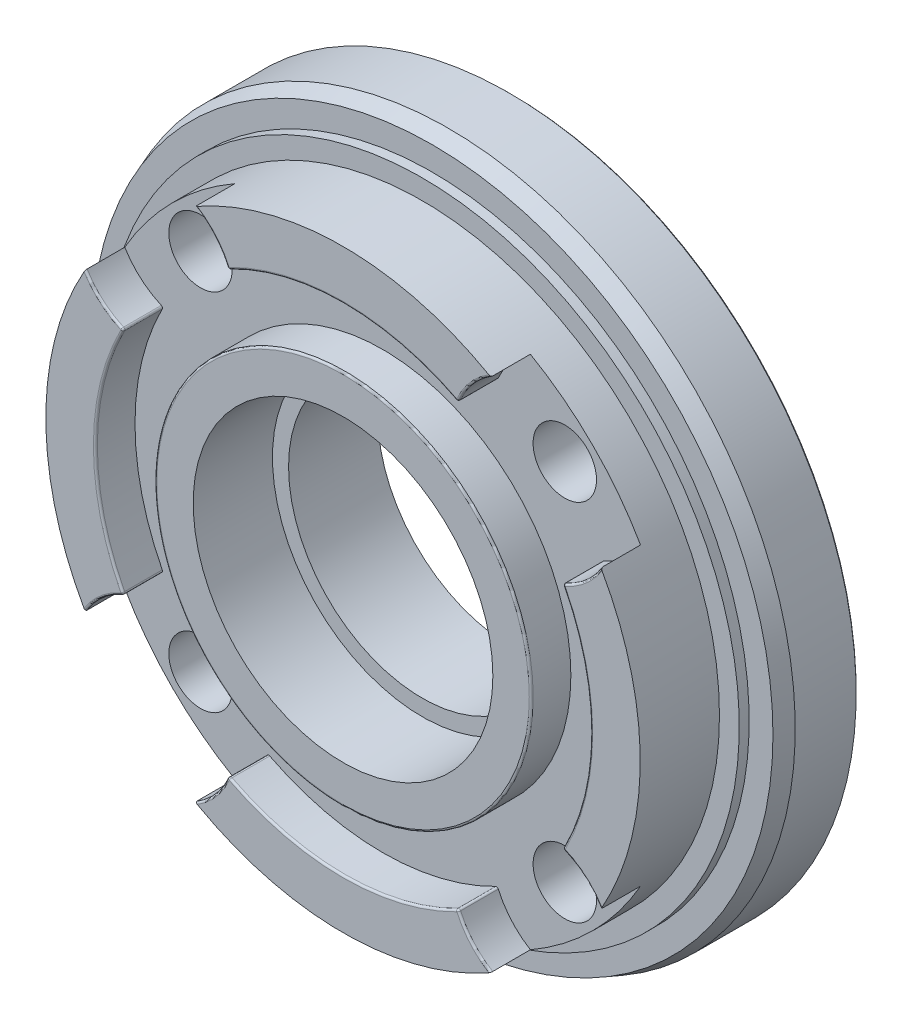
from build123d import *

# Parameters (mm, degrees)
BOSS_EXTRUDE1_DEPTH     = 2
BOSS_EXTRUDE1_2_DEPTH   = 2
BOSS_EXTRUDE1_3_DEPTH   = 2
BOSS_EXTRUDE1_4_DEPTH   = 2
SKETCH1_R               = 9.5
SKETCH1_R_2             = 7.5625
BOSS_EXTRUDE1_5_DEPTH   = 2
BOSS_EXTRUDE2_START     = -2
SKETCH2_R               = 15
BOSS_EXTRUDE2_DEPTH     = 2
FILLET1_R               = 0.1
FILLET2_R               = 0.1
SKETCH4_R               = 16
BOSS_EXTRUDE3_DEPTH     = 0.5
SKETCH5_R               = 17.5
BOSS_EXTRUDE4_DEPTH     = 4
CUT_EXTRUDE2_DEPTH      = 26.154522456
CUT_EXTRUDE2_DEPTH_BACK = 26.154522456
SKETCH3_R               = 1.6
SKETCH6_R               = 2.1
CUT_EXTRUDE3_DEPTH      = 4
SKETCH7_R               = 2.6
CUT_EXTRUDE4_DEPTH      = 4
SKETCH8_R               = 6.75
MIDDLE_CUTOUT_DEPTH     = 7
CHAMFER1_SIZE           = 0.1
CUT_EXTRUDE6_START      = -2
SKETCH9_R               = 7.5625
CUT_EXTRUDE6_DEPTH      = 2
CHAMFER2_SIZE           = 0.3
CHAMFER2_SIZE2          = 0.824243226


with BuildPart() as part:
    # Sketch1 → Boss-Extrude1 (new body)
    with BuildSketch(Plane.XY):
        with BuildLine():
            ThreePointArc((5.795745748, 11.075167323), (6.469207051, 12.179609111), (7.456549067, 13.01537076))
            ThreePointArc((7.456549067, 13.01537076), (0, 15), (-7.456549067, 13.01537076))
            ThreePointArc((-7.456549067, 13.01537076), (-6.469207051, 12.179609111), (-5.795745748, 11.075167323))
            ThreePointArc((-5.795745748, 11.075167323), (0, 12.5), (5.795745748, 11.075167323))
        make_face()
    extrude(amount=BOSS_EXTRUDE1_DEPTH)



with BuildPart() as body_2:
    # Sketch1 → Boss-Extrude1 2 (new body)
    with BuildSketch(Plane.XY):
        with BuildLine():
            ThreePointArc((13.01537076, -7.456549067), (14.495353762, -3.858071967), (15, 0))
            ThreePointArc((15, 0), (14.495353762, 3.858071967), (13.01537076, 7.456549067))
            ThreePointArc((13.01537076, 7.456549067), (12.179609111, 6.469207051), (11.075167323, 5.795745748))
            ThreePointArc((11.075167323, 5.795745748), (12.5, 0), (11.075167323, -5.795745748))
            ThreePointArc((11.075167323, -5.795745748), (12.179609111, -6.469207051), (13.01537076, -7.456549067))
        make_face()
    extrude(amount=BOSS_EXTRUDE1_2_DEPTH)


with BuildPart() as body_3:
    # Sketch1 → Boss-Extrude1 3 (new body)
    with BuildSketch(Plane.XY):
        with BuildLine():
            ThreePointArc((-7.456549067, -13.01537076), (0, -15), (7.456549067, -13.01537076))
            ThreePointArc((7.456549067, -13.01537076), (6.469207051, -12.179609111), (5.795745748, -11.075167323))
            ThreePointArc((5.795745748, -11.075167323), (0, -12.5), (-5.795745748, -11.075167323))
            ThreePointArc((-5.795745748, -11.075167323), (-6.469207051, -12.179609111), (-7.456549067, -13.01537076))
        make_face()
    extrude(amount=BOSS_EXTRUDE1_3_DEPTH)


with BuildPart() as body_4:
    # Sketch1 → Boss-Extrude1 4 (new body)
    with BuildSketch(Plane.XY):
        with BuildLine():
            ThreePointArc((-11.075167323, 5.795745748), (-12.179609111, 6.469207051), (-13.01537076, 7.456549067))
            ThreePointArc((-13.01537076, 7.456549067), (-15, 0), (-13.01537076, -7.456549067))
            ThreePointArc((-13.01537076, -7.456549067), (-12.179609111, -6.469207051), (-11.075167323, -5.795745748))
            ThreePointArc((-11.075167323, -5.795745748), (-12.5, 0), (-11.075167323, 5.795745748))
        make_face()
    extrude(amount=BOSS_EXTRUDE1_4_DEPTH)


with BuildPart() as body_5:
    # Sketch1 → Boss-Extrude1 5 (new body)
    with BuildSketch(Plane.XY):
        Circle(SKETCH1_R)
        Circle(SKETCH1_R_2, mode=Mode.SUBTRACT)
    extrude(amount=BOSS_EXTRUDE1_5_DEPTH)


with BuildPart() as part_1:
    add(part.part)

    add(body_2.part)  # Boss-Extrude2 merges body 2

    add(body_3.part)  # Boss-Extrude2 merges body 3

    add(body_4.part)  # Boss-Extrude2 merges body 4

    add(body_5.part)  # Boss-Extrude2 merges body 5
    # Sketch2 → Boss-Extrude2 (add)
    with BuildSketch(Plane.XY.offset(BOSS_EXTRUDE2_START)):
        with Locations(Location((0, 0, 0), (0, 0, 150.191461703))):
            Circle(SKETCH2_R)
    extrude(amount=BOSS_EXTRUDE2_DEPTH)

    # Fillet1
    fillet1_edges = [part_1.edges().sort_by_distance(p)[0] for p in [
        (11.075167323, 5.795745748, 1),
        (11.075167323, -5.795745748, 1),
        (5.795745748, -11.075167323, 1),
        (-5.795745748, -11.075167323, 1),
        (-11.075167323, -5.795745748, 1),
        (-11.075167323, 5.795745748, 1),
        (5.795745748, 11.075167323, 1),
        (-5.795745748, 11.075167323, 1),
    ]]
    fillet(fillet1_edges, radius=FILLET1_R)

    # Fillet2
    fillet2_edges = [part_1.edges().sort_by_distance(p)[0] for p in [
        (6.504180663, 12.219925602, 2),
        (12.219925602, -6.504180663, 2),
        (-6.504180663, -12.219925602, 2),
        (-12.219925602, 6.504180663, 2),
        (-9.5, 0, 2),
        (0, -12.5, 2),
        (6.504180663, -12.219925602, 2),
        (5.779303749, -11.119440592, 2),
        (-5.779303749, -11.119440592, 2),
        (12.5, 0, 2),
        (12.219925602, 6.504180663, 2),
        (11.119440592, 5.779303749, 2),
        (11.119440592, -5.779303749, 2),
        (0, 12.5, 2),
        (-6.504180663, 12.219925602, 2),
        (-5.779303749, 11.119440592, 2),
        (5.779303749, 11.119440592, 2),
        (-12.5, 0, 2),
        (-12.219925602, -6.504180663, 2),
        (-11.119440592, -5.779303749, 2),
        (-11.119440592, 5.779303749, 2),
    ]]
    fillet(fillet2_edges, radius=FILLET2_R - 0.0001)  # a hair under: the kernel refuses the full size

    # Sketch4 → Boss-Extrude3 (add)
    with BuildSketch(Plane(origin=(0, 0, -2), x_dir=(-1, 0, 0), z_dir=(0, 0, -1))):
        Circle(SKETCH4_R)
    extrude(amount=BOSS_EXTRUDE3_DEPTH)

    # Sketch5 → Boss-Extrude4 (add)
    with BuildSketch(Plane(origin=(0, 0, -2.5), x_dir=(-1, 0, 0), z_dir=(0, 0, -1))):
        Circle(SKETCH5_R)
    extrude(amount=BOSS_EXTRUDE4_DEPTH)

    # Sketch3 → Cut-Extrude2 (cut, two sides: drawn at the far end of the back side and taken through both)
    with BuildSketch(Plane(origin=(0, 0, -2), x_dir=(-1, 0, 0), z_dir=(0, 0, -1)).offset(-CUT_EXTRUDE2_DEPTH_BACK)):
        with Locations((-9.192388155, 9.192388155)):
            Circle(SKETCH3_R)
        with Locations((9.192388155, 9.192388155)):
            Circle(SKETCH3_R)
        with Locations((9.192388155, -9.192388155)):
            Circle(SKETCH3_R)
        with Locations((-9.192388155, -9.192388155)):
            Circle(SKETCH3_R)
    extrude(amount=CUT_EXTRUDE2_DEPTH + CUT_EXTRUDE2_DEPTH_BACK, mode=Mode.SUBTRACT)

    # Sketch6 → Cut-Extrude3 (cut)
    with BuildSketch(Plane(origin=(0, 0, -6.5), x_dir=(-1, 0, 0), z_dir=(0, 0, -1))):
        with Locations((-9.192388155, 9.192388155)):
            Circle(SKETCH6_R)
        with Locations((9.192388155, 9.192388155)):
            Circle(SKETCH6_R)
        with Locations((9.192388155, -9.192388155)):
            Circle(SKETCH6_R)
        with Locations((-9.192388155, -9.192388155)):
            Circle(SKETCH6_R)
    extrude(amount=-CUT_EXTRUDE3_DEPTH, mode=Mode.SUBTRACT)

    # Sketch7 → Cut-Extrude4 (cut)
    with BuildSketch(Plane(origin=(0, 0, -6.5), x_dir=(-1, 0, 0), z_dir=(0, 0, -1))):
        with Locations((0, 13)):
            Circle(SKETCH7_R)
        with Locations((13, 0)):
            Circle(SKETCH7_R)
        with Locations((0, -13)):
            Circle(SKETCH7_R)
        with Locations((-13, 0)):
            Circle(SKETCH7_R)
    extrude(amount=-CUT_EXTRUDE4_DEPTH, mode=Mode.SUBTRACT)

    # Sketch8 → Middle Cutout (cut)
    with BuildSketch(Plane.XY):
        Circle(SKETCH8_R)
    extrude(amount=-MIDDLE_CUTOUT_DEPTH, mode=Mode.SUBTRACT)

    # Chamfer1
    chamfer1_edges = [part_1.edges().sort_by_distance(p)[0] for p in [
        (17.5, 0, -6.5),
    ]]
    chamfer(chamfer1_edges, length=CHAMFER1_SIZE)

    # Sketch9 → Cut-Extrude6 (cut)
    with BuildSketch(Plane.XY.offset(CUT_EXTRUDE6_START)):
        Circle(SKETCH9_R)
    extrude(amount=CUT_EXTRUDE6_DEPTH, mode=Mode.SUBTRACT)

    # Chamfer2
    chamfer2_edges = [part_1.edges().sort_by_distance(p)[0] for p in [
        (17.5, 0, -2.5),
    ]]
    chamfer2_side = [part_1.faces().sort_by_distance(p)[0] for p in [
        (17.005025253, 0, -2.5),
    ]]
    chamfer(chamfer2_edges, length=CHAMFER2_SIZE, length2=CHAMFER2_SIZE2, reference=chamfer2_side[0])


solid = part_1.part
